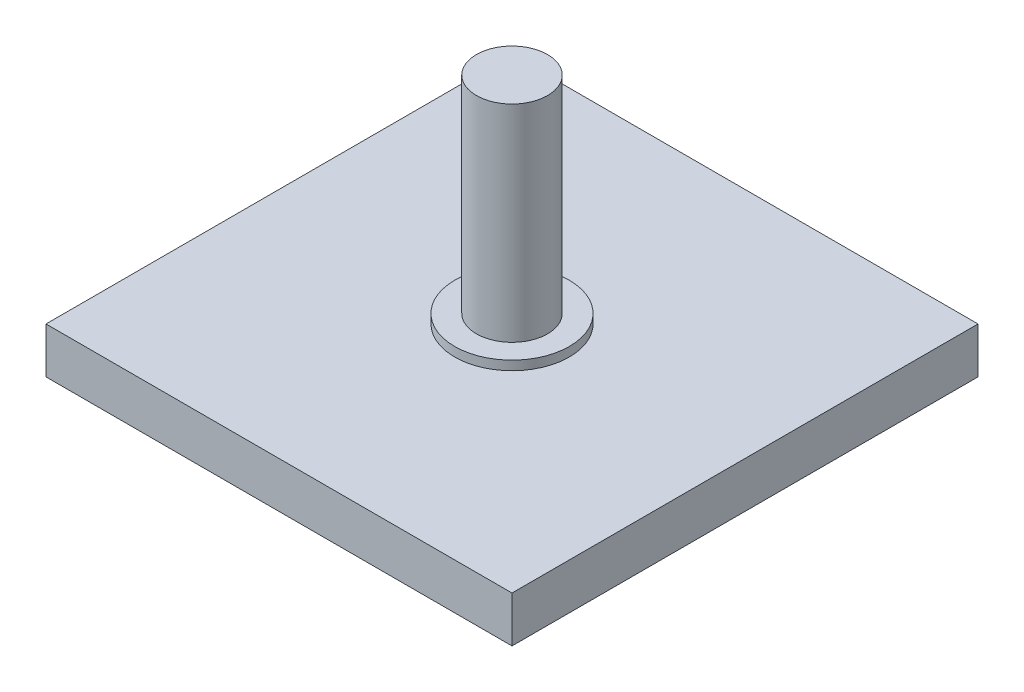
from build123d import *

# Parameters (mm, degrees)
SKETCH1_W           = 101.6
SKETCH1_H           = 101.6
BOSS_EXTRUDE1_DEPTH = 10
SKETCH2_R           = 5
CUT_EXTRUDE1_DEPTH  = 5
SKETCH3_R           = 12.5
BOSS_EXTRUDE2_DEPTH = 2
SKETCH4_R           = 7.75
BOSS_EXTRUDE3_DEPTH = 45


with BuildPart() as part:
    # Sketch1 → Boss-Extrude1 (new body)
    with BuildSketch(Plane(origin=(0, 0, 0), x_dir=(1, 0, 0), z_dir=(0, 1, 0))):
        Rectangle(SKETCH1_W, SKETCH1_H)
    extrude(amount=BOSS_EXTRUDE1_DEPTH)

    # Sketch2 → Cut-Extrude1 (cut)
    with BuildSketch(Plane(origin=(0, 0, 0), x_dir=(-1, 0, 0), z_dir=(0, -1, 0))):
        Circle(SKETCH2_R)
    extrude(amount=-CUT_EXTRUDE1_DEPTH, mode=Mode.SUBTRACT)

    # Sketch3 → Boss-Extrude2 (add)
    with BuildSketch(Plane(origin=(0, 10, 0), x_dir=(1, 0, 0), z_dir=(0, 1, 0))):
        Circle(SKETCH3_R)
    extrude(amount=BOSS_EXTRUDE2_DEPTH)

    # Sketch4 → Boss-Extrude3 (add)
    with BuildSketch(Plane(origin=(0, 12, 0), x_dir=(1, 0, 0), z_dir=(0, 1, 0))):
        Circle(SKETCH4_R)
    extrude(amount=BOSS_EXTRUDE3_DEPTH)


solid = part.part
